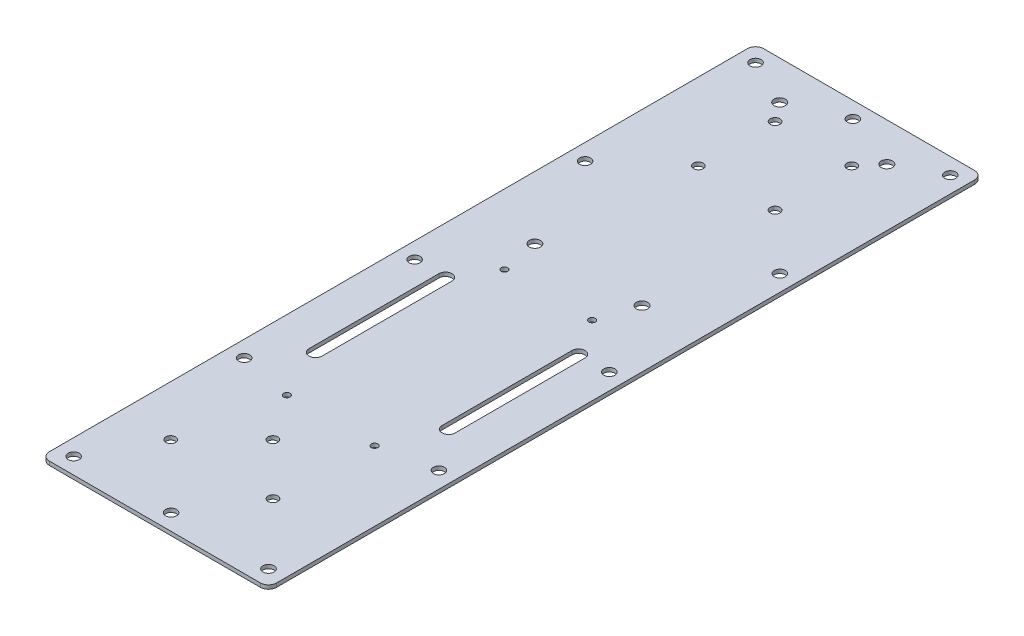
from build123d import *

# Parameters (mm, degrees)
PLATE_THICKNESS_DEPTH      = 1.5
SKETCH3_R                  = 2.159
MOUNTING_HOLES_DEPTH       = 147.608807716
SKETCH4_R                  = 2.2225
JETSON_HOLES_W_MOUNT_DEPTH = 147.608807716
SKETCH5_R                  = 1.905
PDB_HOLES_DEPTH            = 147.608807716
SKETCH6_R                  = 1.905
LIDAR_HOLES_DEPTH          = 147.608807716
SKETCH7_R                  = 1.27
PIXHAWK_HOLES_DEPTH        = 147.608807716
BATTERY_HOLES_DEPTH        = 147.608807716


with BuildPart() as part:
    # Sketch2 → Plate Thickness (new body)
    with BuildSketch(Plane(origin=(0, 0, 0), x_dir=(1, 0, 0), z_dir=(0, 1, 0))):
        with BuildLine():
            Line((-41.275, 139.7), (41.275, 139.7))
            ThreePointArc((41.275, 139.7), (43.52006403, 138.77006403), (44.45, 136.525))
            Line((44.45, 136.525), (44.45, -136.525))
            ThreePointArc((44.45, -136.525), (43.52006403, -138.77006403), (41.275, -139.7))
            Line((41.275, -139.7), (-41.275, -139.7))
            ThreePointArc((-41.275, -139.7), (-43.52006403, -138.77006403), (-44.45, -136.525))
            Line((-44.45, -136.525), (-44.45, 136.525))
            ThreePointArc((-44.45, 136.525), (-43.52006403, 138.77006403), (-41.275, 139.7))
        make_face()
    extrude(amount=PLATE_THICKNESS_DEPTH)

    # Sketch3 → Mounting holes (cut, through all)
    with BuildSketch(Plane(origin=(0, 1.5, 0), x_dir=(1, 0, 0), z_dir=(0, 1, 0))):
        with Locations((-38.1, 133.35)):
            Circle(SKETCH3_R)
        with Locations((-38.1, 66.675)):
            Circle(SKETCH3_R)
        with Locations((-38.1, -66.675)):
            Circle(SKETCH3_R)
        with Locations((-38.1, -133.35)):
            Circle(SKETCH3_R)
        with Locations((38.1, -133.35)):
            Circle(SKETCH3_R)
        with Locations((38.1, -66.675)):
            Circle(SKETCH3_R)
        with Locations((38.1, 66.675)):
            Circle(SKETCH3_R)
        with Locations((38.1, 133.35)):
            Circle(SKETCH3_R)
        with Locations((0, 133.35)):
            Circle(SKETCH3_R)
        with Locations((0, -133.35)):
            Circle(SKETCH3_R)
        with Locations((-38.1, 0)):
            Circle(SKETCH3_R)
        with Locations((38.1, 0)):
            Circle(SKETCH3_R)
    extrude(amount=-MOUNTING_HOLES_DEPTH, mode=Mode.SUBTRACT)

    # Sketch4 → Jetson Holes (w/ mount) (cut, through all)
    with BuildSketch(Plane(origin=(0, 1.5, 0), x_dir=(1, 0, 0), z_dir=(0, 1, 0))):
        with Locations((-19.937372124, 124.652240808)):
            Circle(SKETCH4_R)
        with Locations((-19.937372124, 28.894240808)):
            Circle(SKETCH4_R)
        with Locations((21.972627876, 28.894240808)):
            Circle(SKETCH4_R)
        with Locations((21.972627876, 124.652240808)):
            Circle(SKETCH4_R)
    extrude(amount=-JETSON_HOLES_W_MOUNT_DEPTH, mode=Mode.SUBTRACT)

    # Sketch5 → PDB holes (cut, through all)
    with BuildSketch(Plane(origin=(0, 1.5, 0), x_dir=(1, 0, 0), z_dir=(0, 1, 0))):
        with Locations((-14.341868752, 117.235149692)):
            Circle(SKETCH5_R)
        with Locations((15.655531248, 117.235149692)):
            Circle(SKETCH5_R)
        with Locations((15.655531248, 87.237749692)):
            Circle(SKETCH5_R)
        with Locations((-14.341868752, 87.237749692)):
            Circle(SKETCH5_R)
    extrude(amount=-PDB_HOLES_DEPTH, mode=Mode.SUBTRACT)

    # Sketch6 → Lidar Holes (cut, through all)
    with BuildSketch(Plane(origin=(0, 1.5, 0), x_dir=(1, 0, 0), z_dir=(0, 1, 0))):
        with Locations((-24.793877358, -108.717504265)):
            Circle(SKETCH6_R)
        with Locations((15.211122642, -108.717504265)):
            Circle(SKETCH6_R)
        with Locations((-4.804077358, -88.727704265)):
            Circle(SKETCH6_R)
    extrude(amount=-LIDAR_HOLES_DEPTH, mode=Mode.SUBTRACT)

    # Sketch7 → PixHawk Holes (cut, through all)
    with BuildSketch(Plane(origin=(0, 1.5, 0), x_dir=(1, 0, 0), z_dir=(0, 1, 0))):
        with Locations((-17.145, 14.172396373)):
            Circle(SKETCH7_R)
        with Locations((-17.145, -70.917603627)):
            Circle(SKETCH7_R)
        with Locations((17.145, -70.917603627)):
            Circle(SKETCH7_R)
        with Locations((17.145, 14.172396373)):
            Circle(SKETCH7_R)
    extrude(amount=-PIXHAWK_HOLES_DEPTH, mode=Mode.SUBTRACT)

    # Sketch8 → Battery Holes (cut, through all)
    with BuildSketch(Plane(origin=(0, 1.5, 0), x_dir=(1, 0, 0), z_dir=(0, 1, 0))):
        with BuildLine():
            Line((-23.495, -0.005964701), (-23.495, -50.805964701))
            ThreePointArc((-23.495, -50.805964701), (-26.035, -53.345964701), (-28.575, -50.805964701))
            Line((-28.575, -50.805964701), (-28.575, -0.005964701))
            ThreePointArc((-28.575, -0.005964701), (-26.035, 2.534035299), (-23.495, -0.005964701))
        make_face()
        with BuildLine():
            Line((23.495, -0.005964701), (23.495, -50.805964701))
            ThreePointArc((23.495, -50.805964701), (26.035, -53.345964701), (28.575, -50.805964701))
            Line((28.575, -50.805964701), (28.575, -0.005964701))
            ThreePointArc((28.575, -0.005964701), (26.035, 2.534035299), (23.495, -0.005964701))
        make_face()
    extrude(amount=-BATTERY_HOLES_DEPTH, mode=Mode.SUBTRACT)


solid = part.part
